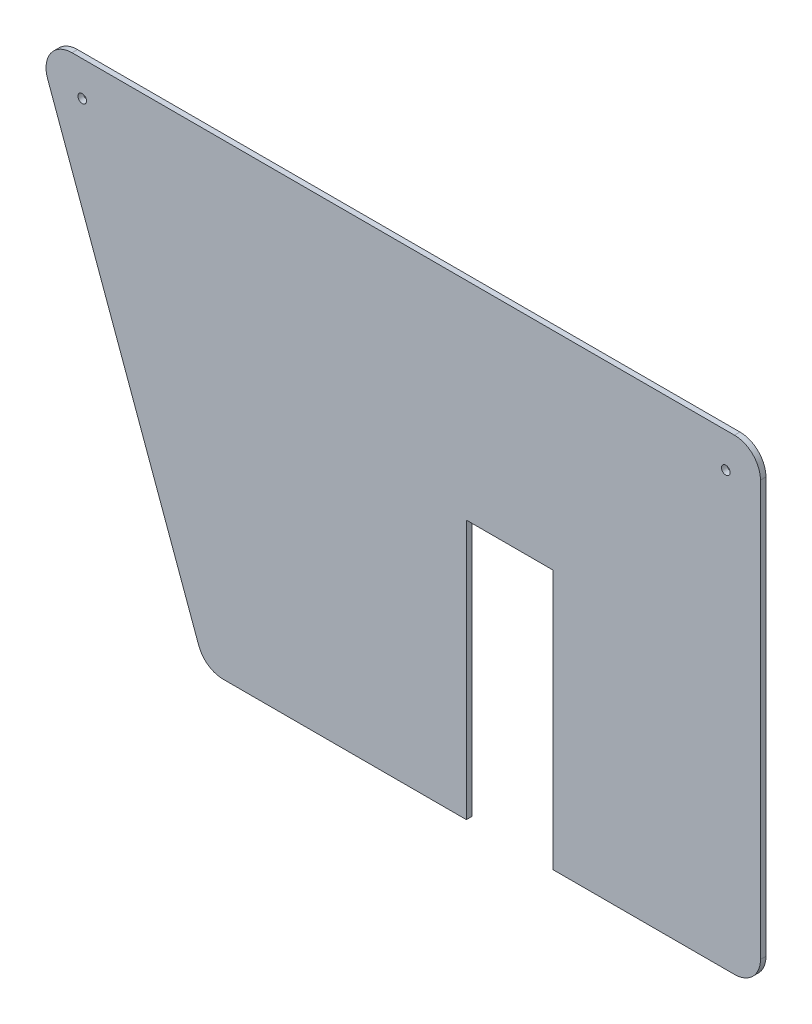
from build123d import *

# Parameters (mm, degrees)
BASE_FLANGE1_DEPTH = 3.175
FILLET1_R          = 15
SKETCH2_W          = 50
SKETCH2_H          = 150
CUT_EXTRUDE1_DEPTH = 10
SKETCH3_R          = 2.5
CUT_EXTRUDE2_DEPTH = 10


# Sheet-metal steps are written as plain solids
with BuildPart() as part:
    # Sketch1 → Base-Flange1 (new body)
    with BuildSketch(Plane.XY):
        Polygon((0, 270), (0, 0), (-321.154386438, 0), (-419.42634969, 270), align=None)
    extrude(amount=-BASE_FLANGE1_DEPTH)

    # Fillet1
    fillet1_edges = [part.edges().sort_by_distance(p)[0] for p in [
        (0, 270, -1.5875),
        (0, 0, -1.5875),
        (-321.154386438, 0, -1.5875),
        (-419.42634969, 270, -1.5875),
    ]]
    fillet(fillet1_edges, radius=FILLET1_R)

    # Sketch2 → Cut-Extrude1 (cut)
    with BuildSketch(Plane(origin=(0, 0, -3.175), x_dir=(-1, 0, 0), z_dir=(0, 0, -1))):
        with Locations((145, 75)):
            Rectangle(SKETCH2_W, SKETCH2_H)
    extrude(amount=-CUT_EXTRUDE1_DEPTH, mode=Mode.SUBTRACT)

    # Sketch3 → Cut-Extrude2 (cut)
    with BuildSketch(Plane(origin=(0, 0, -3.175), x_dir=(-1, 0, 0), z_dir=(0, 0, -1))):
        with Locations((20, 250)):
            Circle(SKETCH3_R)
        with Locations((392.099518901, 250)):
            Circle(SKETCH3_R)
    extrude(amount=-CUT_EXTRUDE2_DEPTH, mode=Mode.SUBTRACT)


solid = part.part
